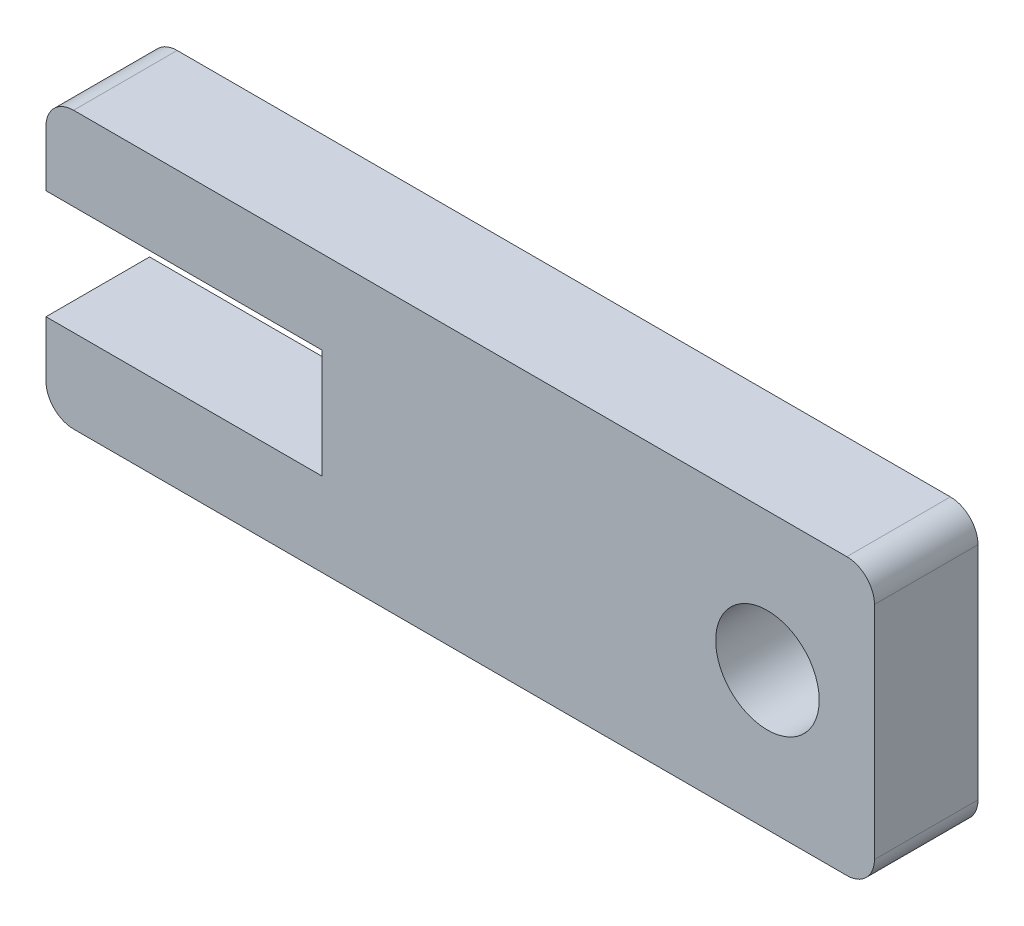
from build123d import *

# Parameters (mm, degrees)
BOSS_EXTRUDE1_DEPTH = 2.38125
FILLET1_R           = 1.27
SKETCH2_R           = 2.38125
CUT_EXTRUDE1_DEPTH  = 27.6113492


with BuildPart() as part:
    # Sketch1 → Boss-Extrude1 (new, symmetric)
    with BuildSketch(Plane.XY):
        Polygon((-12.7, 2.50825), (-12.7, 6.35), (25.4, 6.35), (25.4, -6.35), (-12.7, -6.35), (-12.7, -2.50825), (0, -2.50825), (0, 2.50825), align=None)
    extrude(amount=BOSS_EXTRUDE1_DEPTH, both=True)

    # Fillet1
    fillet1_edges = [part.edges().sort_by_distance(p)[0] for p in [
        (-12.7, -6.35, 0),
        (25.4, -6.35, 0),
        (25.4, 6.35, 0),
        (-12.7, 6.35, 0),
    ]]
    fillet(fillet1_edges, radius=FILLET1_R)

    # Sketch2 → Cut-Extrude1 (cut, through all)
    with BuildSketch(Plane.XY.offset(2.38125)):
        with Locations((20.47875, 0)):
            Circle(SKETCH2_R)
    extrude(amount=-CUT_EXTRUDE1_DEPTH, mode=Mode.SUBTRACT)


solid = part.part
